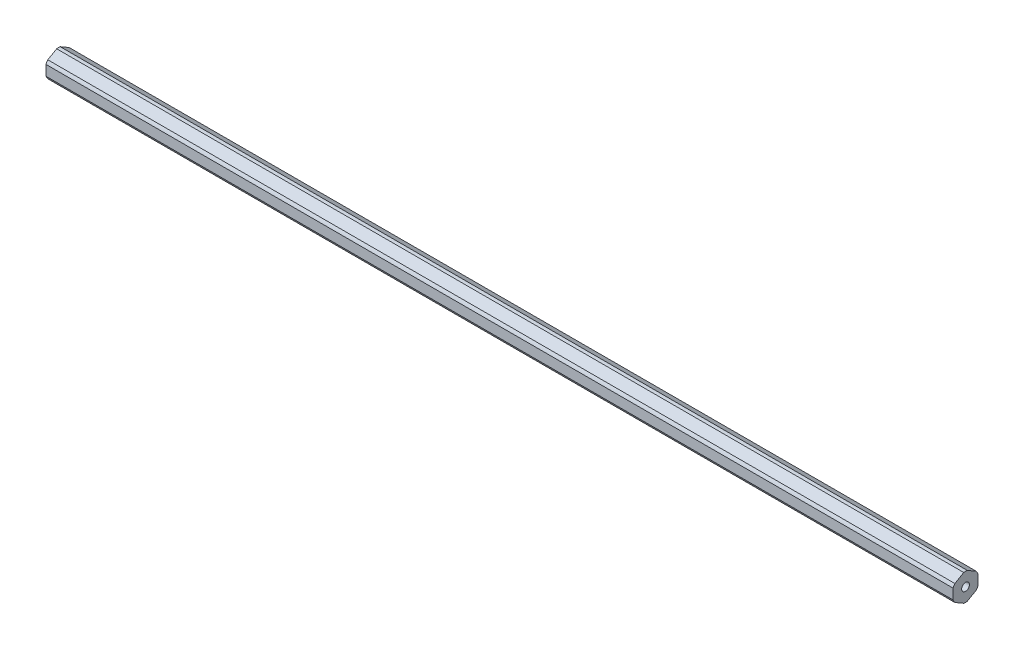
from build123d import *

# Parameters (mm, degrees)
SKETCH1_R           = 1.9939
BOSS_EXTRUDE1_DEPTH = 462.534


with BuildPart() as part:
    # Sketch1 → Boss-Extrude1 (new body)
    with BuildSketch(Plane(origin=(914.4, 0, 0), x_dir=(0, 0, -1), z_dir=(1, 0, 0))):
        with BuildLine():
            Line((-5.43426841, -4.194872089), (-0.91573159, -6.803650539))
            ThreePointArc((-0.91573159, -6.803650539), (0, -6.865), (0.91573159, -6.803650539))
            Line((0.91573159, -6.803650539), (5.43426841, -4.194872089))
            ThreePointArc((5.43426841, -4.194872089), (5.945264397, -3.4325), (6.35, -2.60877845))
            Line((6.35, -2.60877845), (6.35, 2.60877845))
            ThreePointArc((6.35, 2.60877845), (5.945264397, 3.4325), (5.43426841, 4.194872089))
            Line((5.43426841, 4.194872089), (0.91573159, 6.803650539))
            ThreePointArc((0.91573159, 6.803650539), (0, 6.865), (-0.91573159, 6.803650539))
            Line((-0.91573159, 6.803650539), (-5.43426841, 4.194872089))
            ThreePointArc((-5.43426841, 4.194872089), (-5.945264397, 3.4325), (-6.35, 2.60877845))
            Line((-6.35, 2.60877845), (-6.35, -2.60877845))
            ThreePointArc((-6.35, -2.60877845), (-5.945264397, -3.4325), (-5.43426841, -4.194872089))
        make_face()
        Circle(SKETCH1_R, mode=Mode.SUBTRACT)
    extrude(amount=-BOSS_EXTRUDE1_DEPTH)


solid = part.part
